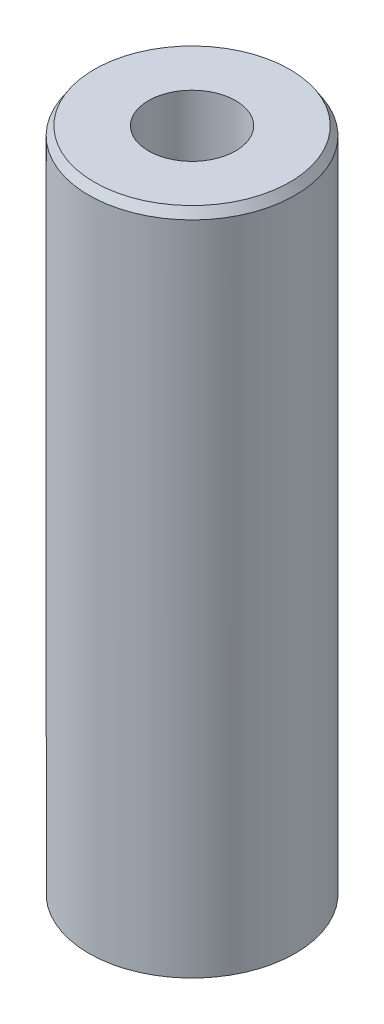
from build123d import *
from OCP.BRepFilletAPI import BRepFilletAPI_MakeChamfer

# Parameters (mm, degrees)
SKETCH1_R           = 7.5
BOSS_EXTRUDE1_DEPTH = 48.732852762
SKETCH2_R           = 3.169220359
CUT_EXTRUDE1_DEPTH  = 50.873749992
CHAMFER1_SIZE       = 0.623981087
CHAMFER1_SIZE2      = 0.39741026


with BuildPart() as part:
    # Sketch1 → Boss-Extrude1 (new body)
    with BuildSketch(Plane(origin=(0, 0, 0), x_dir=(1, 0, 0), z_dir=(0, 1, 0))):
        Circle(SKETCH1_R)
    extrude(amount=BOSS_EXTRUDE1_DEPTH)

    # Sketch2 → Cut-Extrude1 (cut, through all)
    with BuildSketch(Plane(origin=(0, 0, 0), x_dir=(1, 0, 0), z_dir=(0, 1, 0))):
        Circle(SKETCH2_R)
    extrude(amount=CUT_EXTRUDE1_DEPTH, mode=Mode.SUBTRACT)

    # Chamfer1: one chamfer whose edges measure the first distance from different faces: ONE call of the kernel's chamfer builder (chamfer() names one face for all edges)
    chamfer1_edges_1 = [part.edges().sort_by_distance(p)[0] for p in [
        (-7.5, 48.732852762, 0),
    ]]
    chamfer1_side_1 = [part.faces().sort_by_distance(p)[0] for p in [
        (-7.5, 24.366426381, 0),
    ]]
    chamfer1_edges_2 = [part.edges().sort_by_distance(p)[0] for p in [
        (-7.5, 0, 0),
    ]]
    chamfer1_side_2 = [part.faces().sort_by_distance(p)[0] for p in [
        (-7.287867966, 0, 0),
    ]]
    chamfer1 = BRepFilletAPI_MakeChamfer(part.part.solid().wrapped)
    for e in chamfer1_edges_1:
        chamfer1.Add(CHAMFER1_SIZE, CHAMFER1_SIZE2, e.wrapped, chamfer1_side_1[0].wrapped)  # the first distance lies on this face
    for e in chamfer1_edges_2:
        chamfer1.Add(CHAMFER1_SIZE, CHAMFER1_SIZE2, e.wrapped, chamfer1_side_2[0].wrapped)  # the first distance lies on this face
    add(Compound.cast(chamfer1.Shape()), mode=Mode.REPLACE)


solid = part.part
